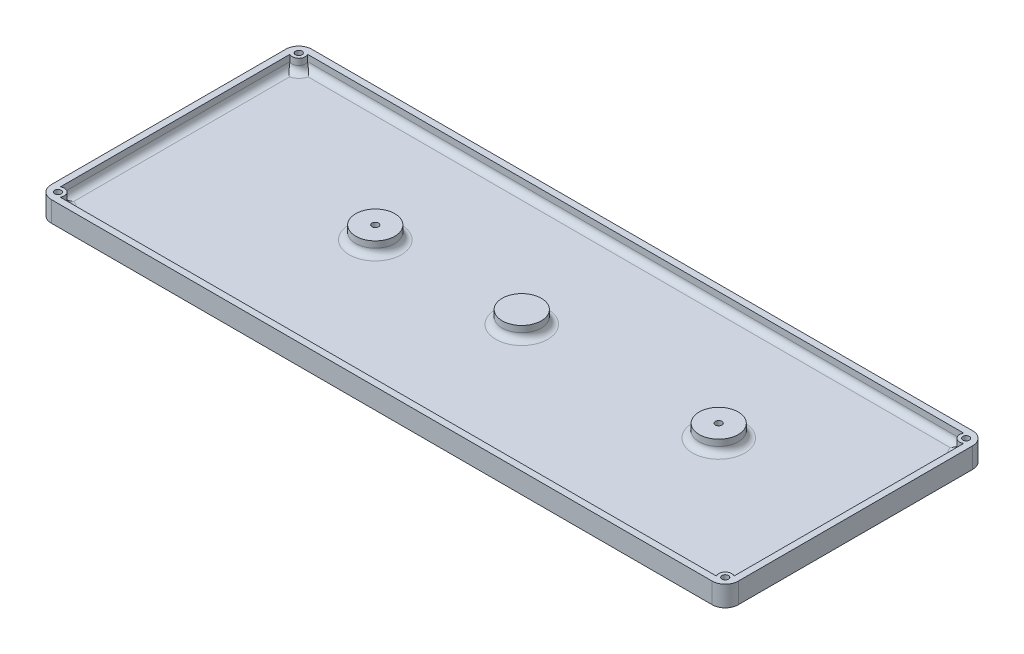
from build123d import *

# Parameters (mm, degrees)
BOSS_EXTRUDE1_DEPTH = 3
BOSS_EXTRUDE2_DEPTH = 5
SKETCH3_R           = 7.62
SKETCH3_R_2         = 1.27
SKETCH3_R_3         = 2.54
BOSS_EXTRUDE3_DEPTH = 5
FILLET1_R           = 2.54
SKETCH4_R           = 3
CUT_EXTRUDE1_DEPTH  = 4
FILLET2_R           = 0.635
CUT_EXTRUDE2_START  = -5
SKETCH5_R           = 1.27
CUT_EXTRUDE2_DEPTH  = 5


with BuildPart() as part:
    # Sketch1 → Boss-Extrude1 (new body)
    with BuildSketch(Plane(origin=(0, 0, 0), x_dir=(1, 0, 0), z_dir=(0, 1, 0))):
        with BuildLine():
            Line((-128.905, 50.8), (128.905, 50.8))
            ThreePointArc((128.905, 50.8), (132.497102448, 49.312102448), (133.985, 45.72))
            Line((133.985, 45.72), (133.985, -45.72))
            ThreePointArc((133.985, -45.72), (132.497102448, -49.312102448), (128.905, -50.8))
            Line((128.905, -50.8), (-128.905, -50.8))
            ThreePointArc((-128.905, -50.8), (-132.497102448, -49.312102448), (-133.985, -45.72))
            Line((-133.985, -45.72), (-133.985, 45.72))
            ThreePointArc((-133.985, 45.72), (-132.497102448, 49.312102448), (-128.905, 50.8))
        make_face()
    extrude(amount=BOSS_EXTRUDE1_DEPTH)

    # Sketch2 → Boss-Extrude2 (add)
    with BuildSketch(Plane(origin=(0, 3, 0), x_dir=(1, 0, 0), z_dir=(0, 1, 0))):
        with BuildLine():
            Line((-128.905, -50.8), (128.905, -50.8))
            ThreePointArc((128.905, -50.8), (132.497102448, -49.312102448), (133.985, -45.72))
            Line((133.985, -45.72), (133.985, 45.72))
            ThreePointArc((133.985, 45.72), (132.497102448, 49.312102448), (128.905, 50.8))
            Line((128.905, 50.8), (-128.905, 50.8))
            ThreePointArc((-128.905, 50.8), (-132.497102448, 49.312102448), (-133.985, 45.72))
            Line((-133.985, 45.72), (-133.985, -45.72))
            ThreePointArc((-133.985, -45.72), (-132.497102448, -49.312102448), (-128.905, -50.8))
        make_face()
        with BuildLine():
            Line((-128.905, -48.26), (128.905, -48.26))
            ThreePointArc((128.905, -48.26), (130.701051224, -47.516051224), (131.445, -45.72))
            Line((131.445, -45.72), (131.445, 45.72))
            ThreePointArc((131.445, 45.72), (130.701051224, 47.516051224), (128.905, 48.26))
            Line((128.905, 48.26), (-128.905, 48.26))
            ThreePointArc((-128.905, 48.26), (-130.701051224, 47.516051224), (-131.445, 45.72))
            Line((-131.445, 45.72), (-131.445, -45.72))
            ThreePointArc((-131.445, -45.72), (-130.701051224, -47.516051224), (-128.905, -48.26))
        make_face(mode=Mode.SUBTRACT)
    extrude(amount=BOSS_EXTRUDE2_DEPTH)

    # Sketch3 → Boss-Extrude3 (add)
    # profile 1 of 7: a face of its own
    with BuildSketch(Plane(origin=(0, 3, 0), x_dir=(1, 0, 0), z_dir=(0, 1, 0))):
        with Locations((-57.15, 3.81)):
            Circle(SKETCH3_R)
        with Locations((-57.15, 3.81)):
            Circle(SKETCH3_R_2, mode=Mode.SUBTRACT)
    # profile 2 of 7: a face of its own
    with BuildSketch(Plane(origin=(0, 3, 0), x_dir=(1, 0, 0), z_dir=(0, 1, 0))):
        with Locations((0, 3.81)):
            Circle(SKETCH3_R)
    # profile 3 of 7: a face of its own
    with BuildSketch(Plane(origin=(0, 3, 0), x_dir=(1, 0, 0), z_dir=(0, 1, 0))):
        with Locations((76.835, 3.81)):
            Circle(SKETCH3_R)
        with Locations((76.835, 3.81)):
            Circle(SKETCH3_R_2, mode=Mode.SUBTRACT)
    # profile 4 of 7: a face of its own
    with BuildSketch(Plane(origin=(0, 3, 0), x_dir=(1, 0, 0), z_dir=(0, 1, 0))):
        with Locations((130.175, 46.99)):
            Circle(SKETCH3_R_3)
        with Locations((130.175, 46.99)):
            Circle(SKETCH3_R_2, mode=Mode.SUBTRACT)
    # profile 5 of 7: a face of its own
    with BuildSketch(Plane(origin=(0, 3, 0), x_dir=(1, 0, 0), z_dir=(0, 1, 0))):
        with Locations((-130.175, 46.99)):
            Circle(SKETCH3_R_3)
        with Locations((-130.175, 46.99)):
            Circle(SKETCH3_R_2, mode=Mode.SUBTRACT)
    # profile 6 of 7: a face of its own
    with BuildSketch(Plane(origin=(0, 3, 0), x_dir=(1, 0, 0), z_dir=(0, 1, 0))):
        with Locations((-130.175, -46.99)):
            Circle(SKETCH3_R_3)
        with Locations((-130.175, -46.99)):
            Circle(SKETCH3_R_2, mode=Mode.SUBTRACT)
    # profile 7 of 7: a face of its own
    with BuildSketch(Plane(origin=(0, 3, 0), x_dir=(1, 0, 0), z_dir=(0, 1, 0))):
        with Locations((130.175, -46.99)):
            Circle(SKETCH3_R_3)
        with Locations((130.175, -46.99)):
            Circle(SKETCH3_R_2, mode=Mode.SUBTRACT)
    extrude(amount=BOSS_EXTRUDE3_DEPTH)

    # Fillet1
    fillet1_edges = [part.edges().sort_by_distance(p)[0] for p in [
        (-131.445, 3, 0),
        (0, 3, -48.26),
        (131.445, 3, 0),
        (0, 3, 48.26),
        (-64.77, 3, -3.81),
        (-7.62, 3, -3.81),
        (69.215, 3, -3.81),
        (-128.378948776, 3, 45.193948776),
        (-128.378948776, 3, -45.193948776),
        (128.378948776, 3, -45.193948776),
        (128.378948776, 3, 45.193948776),
    ]]
    fillet(fillet1_edges, radius=FILLET1_R)

    # Sketch4 → Cut-Extrude1 (cut)
    with BuildSketch(Plane.XZ):
        with Locations((-57.15, -3.81)):
            Circle(SKETCH4_R)
        with Locations((76.835, -3.81)):
            Circle(SKETCH4_R)
    extrude(amount=-CUT_EXTRUDE1_DEPTH, mode=Mode.SUBTRACT)

    # Fillet2
    fillet2_edges = [part.edges().sort_by_distance(p)[0] for p in [
        (73.835, 0, -3.81),
        (-60.15, 0, -3.81),
    ]]
    fillet(fillet2_edges, radius=FILLET2_R)

    # Sketch5 → Cut-Extrude2 (cut)
    with BuildSketch(Plane(origin=(0, 8, 0), x_dir=(1, 0, 0), z_dir=(0, 1, 0)).offset(CUT_EXTRUDE2_START)):
        with Locations((130.175, 46.99)):
            Circle(SKETCH5_R)
        with Locations((130.175, -46.99)):
            Circle(SKETCH5_R)
        with Locations((-130.175, -46.99)):
            Circle(SKETCH5_R)
        with Locations((-130.175, 46.99)):
            Circle(SKETCH5_R)
    extrude(amount=CUT_EXTRUDE2_DEPTH, mode=Mode.SUBTRACT)


solid = part.part
